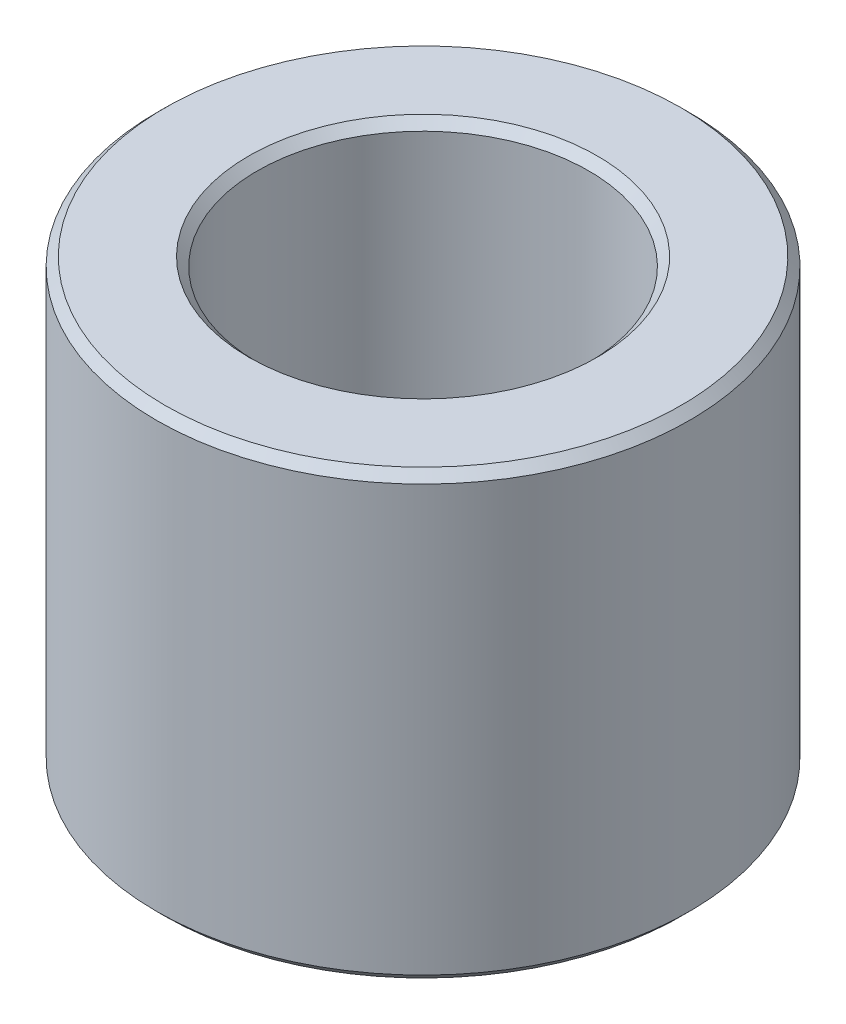
from build123d import *

# Parameters (mm, degrees)
SKETCH1_R           = 35
BOSS_EXTRUDE1_DEPTH = 58.094792606
SKETCH2_R           = 21.764158727
CUT_EXTRUDE1_DEPTH  = 77.321719897
CHAMFER1_SIZE       = 1.130559433


with BuildPart() as part:
    # Sketch1 → Boss-Extrude1 (new body)
    with BuildSketch(Plane(origin=(0, 0, 0), x_dir=(1, 0, 0), z_dir=(0, 1, 0))):
        Circle(SKETCH1_R)
    extrude(amount=BOSS_EXTRUDE1_DEPTH)

    # Sketch2 → Cut-Extrude1 (cut, through all)
    with BuildSketch(Plane(origin=(0, 0, 0), x_dir=(1, 0, 0), z_dir=(0, 1, 0))):
        Circle(SKETCH2_R)
    extrude(amount=CUT_EXTRUDE1_DEPTH, mode=Mode.SUBTRACT)

    # Chamfer1
    chamfer1_edges = [part.edges().sort_by_distance(p)[0] for p in [
        (-21.764158727, 58.094792606, 0),
        (-21.764158727, 0, 0),
        (-35, 0, 0),
        (-35, 58.094792606, 0),
    ]]
    chamfer(chamfer1_edges, length=CHAMFER1_SIZE)


solid = part.part
